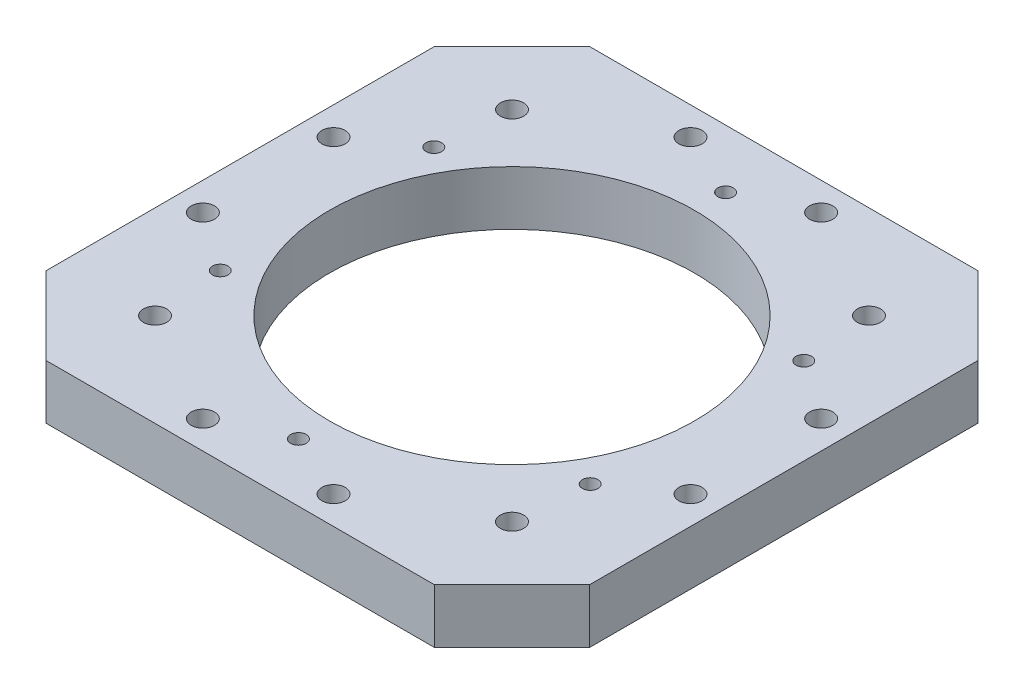
from build123d import *

# Parameters (mm, degrees)
SKETCH1_W           = 70
SKETCH1_H           = 70
SKETCH1_R           = 23.5
SKETCH1_R_2         = 1
SKETCH1_R_3         = 1.5
BOSS_EXTRUDE1_DEPTH = 7
CHAMFER1_SIZE       = 10


with BuildPart() as part:
    # Sketch1 → Boss-Extrude1 (new body)
    with BuildSketch(Plane(origin=(0, 0, 0), x_dir=(1, 0, 0), z_dir=(0, 1, 0))):
        Rectangle(SKETCH1_W, SKETCH1_H)
        Circle(SKETCH1_R, mode=Mode.SUBTRACT)
        with Locations((0, 27.5)):
            Circle(SKETCH1_R_2, mode=Mode.SUBTRACT)
        with Locations((23.815698604, 13.75)):
            Circle(SKETCH1_R_2, mode=Mode.SUBTRACT)
        with Locations((23.815698604, -13.75)):
            Circle(SKETCH1_R_2, mode=Mode.SUBTRACT)
        with Locations((0, -27.5)):
            Circle(SKETCH1_R_2, mode=Mode.SUBTRACT)
        with Locations((-23.815698604, -13.75)):
            Circle(SKETCH1_R_2, mode=Mode.SUBTRACT)
        with Locations((-23.815698604, 13.75)):
            Circle(SKETCH1_R_2, mode=Mode.SUBTRACT)
        with Locations((-31.392589354, -8.411618966)):
            Circle(SKETCH1_R_3, mode=Mode.SUBTRACT)
        with Locations((-31.392589354, 8.411618966)):
            Circle(SKETCH1_R_3, mode=Mode.SUBTRACT)
        with Locations((-22.980970389, 22.980970389)):
            Circle(SKETCH1_R_3, mode=Mode.SUBTRACT)
        with Locations((-8.411618966, 31.392589354)):
            Circle(SKETCH1_R_3, mode=Mode.SUBTRACT)
        with Locations((8.411618966, 31.392589354)):
            Circle(SKETCH1_R_3, mode=Mode.SUBTRACT)
        with Locations((22.980970389, 22.980970389)):
            Circle(SKETCH1_R_3, mode=Mode.SUBTRACT)
        with Locations((31.392589354, 8.411618966)):
            Circle(SKETCH1_R_3, mode=Mode.SUBTRACT)
        with Locations((31.392589354, -8.411618966)):
            Circle(SKETCH1_R_3, mode=Mode.SUBTRACT)
        with Locations((22.980970389, -22.980970389)):
            Circle(SKETCH1_R_3, mode=Mode.SUBTRACT)
        with Locations((8.411618966, -31.392589354)):
            Circle(SKETCH1_R_3, mode=Mode.SUBTRACT)
        with Locations((-8.411618966, -31.392589354)):
            Circle(SKETCH1_R_3, mode=Mode.SUBTRACT)
        with Locations((-22.980970389, -22.980970389)):
            Circle(SKETCH1_R_3, mode=Mode.SUBTRACT)
    extrude(amount=BOSS_EXTRUDE1_DEPTH)

    # Chamfer1
    chamfer1_edges = [part.edges().sort_by_distance(p)[0] for p in [
        (-35, 3.5, 35),
        (35, 3.5, 35),
        (35, 3.5, -35),
        (-35, 3.5, -35),
    ]]
    chamfer(chamfer1_edges, length=CHAMFER1_SIZE)


solid = part.part
